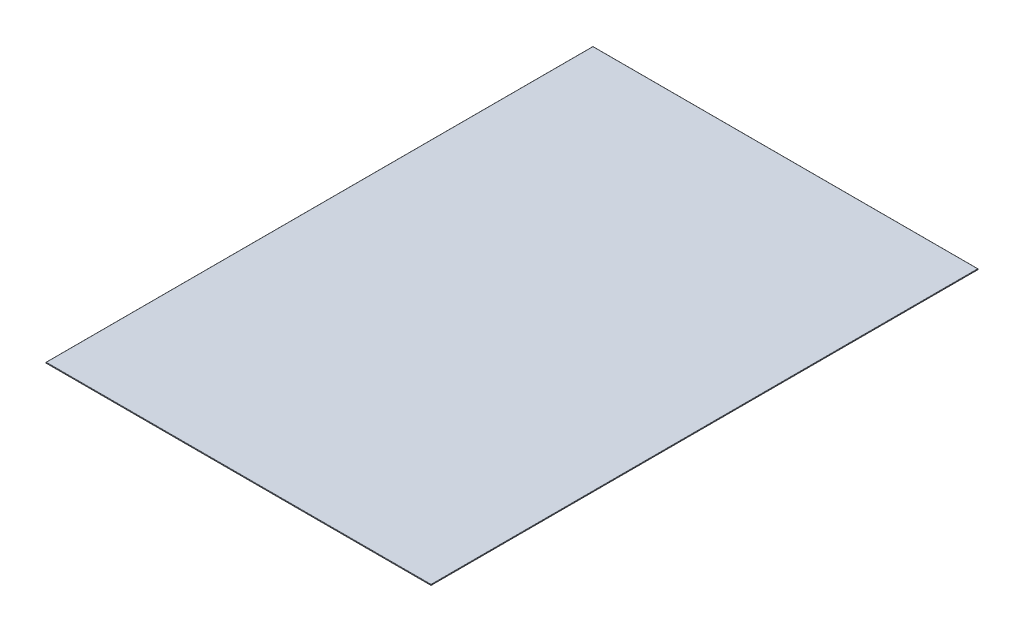
from build123d import *

# Parameters (mm, degrees)
SKETCH1_W           = 2000
SKETCH1_H           = 2000
BOSS_EXTRUDE1_DEPTH = 3.175
SKETCH4_W           = 591.824229309
SKETCH4_H           = 2000
CUT_EXTRUDE1_DEPTH  = 2829.428906765
FILLET1_R           = 1


with BuildPart() as part:
    # Sketch1 → Boss-Extrude1 (new body)
    with BuildSketch(Plane(origin=(0, 0, 0), x_dir=(1, 0, 0), z_dir=(0, 1, 0))):
        with Locations((1000, -1000)):
            Rectangle(SKETCH1_W, SKETCH1_H)
    extrude(amount=BOSS_EXTRUDE1_DEPTH)

    # Sketch4 → Cut-Extrude1 (cut, through all)
    with BuildSketch(Plane(origin=(0, 3.175, 0), x_dir=(1, 0, 0), z_dir=(0, 1, 0))):
        with Locations((295.912114655, -1000)):
            Rectangle(SKETCH4_W, SKETCH4_H)
    extrude(amount=-CUT_EXTRUDE1_DEPTH, mode=Mode.SUBTRACT)

    # Fillet1
    fillet1_edges = [part.edges().sort_by_distance(p)[0] for p in [
        (591.824229309, 1.5875, 2000),
        (2000, 1.5875, 2000),
        (2000, 1.5875, 0),
        (591.824229309, 1.5875, 0),
        (1295.912114654, 3.175, 0),
        (2000, 3.175, 1000),
        (1295.912114654, 3.175, 2000),
        (591.824229309, 3.175, 1000),
        (2000, 0, 1000),
        (1295.912114654, 0, 0),
        (591.824229309, 0, 1000),
        (1295.912114654, 0, 2000),
    ]]
    fillet(fillet1_edges, radius=FILLET1_R)


solid = part.part
